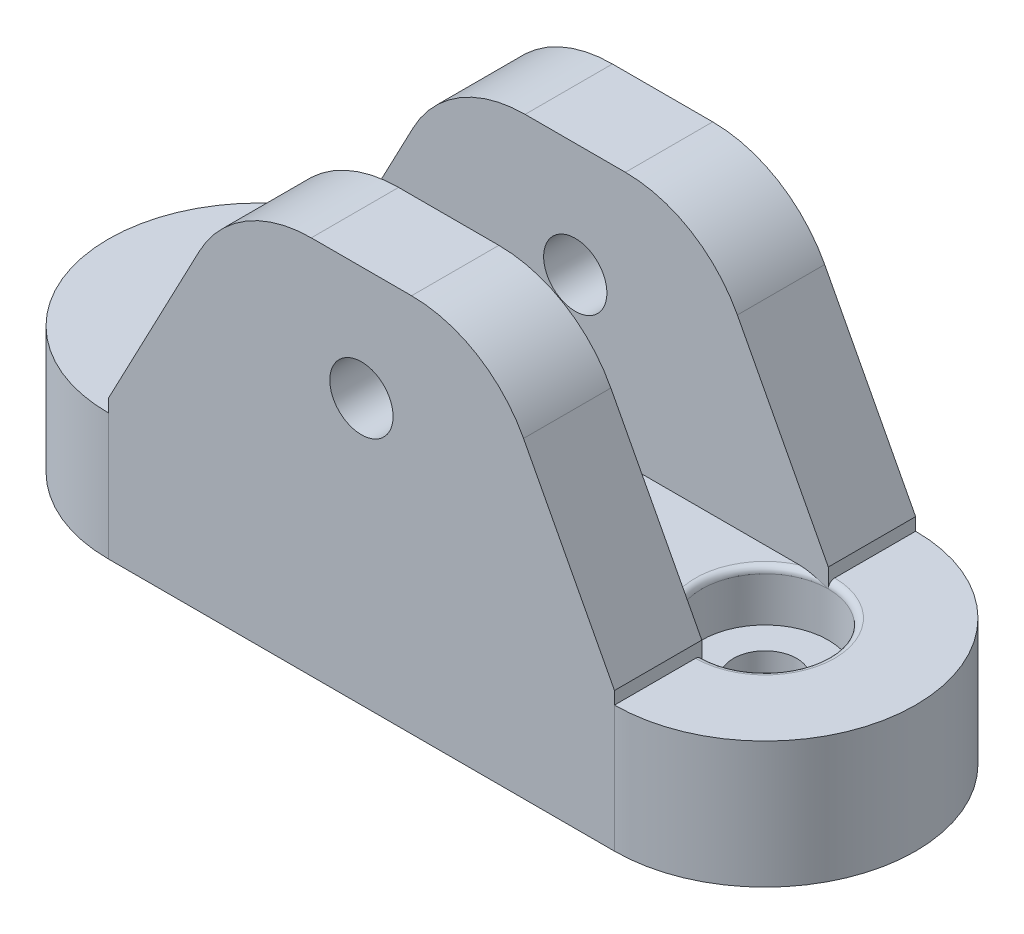
from build123d import *

# Parameters (mm, degrees)
CROQUIS1_R              = 2.5
SALIENTE_EXTRUIR1_DEPTH = 10
CROQUIS3_R              = 2.5
SALIENTE_EXTRUIR2_DEPTH = 6.9
MATRIZL1_COUNT          = 2
MATRIZL1_PITCH          = 16.9
CROQUIS6_R              = 5
CORTAR_EXTRUIR1_DEPTH   = 4
REDONDEO3_R             = 0.5


with BuildPart() as part:
    # Croquis1 → Saliente-Extruir1 (new body)
    with BuildSketch(Plane(origin=(0, 0, 0), x_dir=(1, 0, 0), z_dir=(0, 1, 0))):
        with BuildLine():
            Line((0, -11.9), (-40, -11.9))
            ThreePointArc((-40, -11.9), (-51.9, 0), (-40, 11.9))
            Line((-40, 11.9), (0, 11.9))
            ThreePointArc((0, 11.9), (11.9, 0), (0, -11.9))
        make_face()
        with Locations(Location((-40, 0, 0), (0, 0, 270))):
            Circle(CROQUIS1_R, mode=Mode.SUBTRACT)
        with Locations(Location((0, 0, 0), (0, 0, 90))):
            Circle(CROQUIS1_R, mode=Mode.SUBTRACT)
    extrude(amount=SALIENTE_EXTRUIR1_DEPTH)

    # Croquis3 → Saliente-Extruir2 (add)
    with BuildSketch(Plane.XY.offset(11.9)):
        with BuildLine():
            Line((-40, 10), (-40, 11))
            Line((-40, 11), (-32.81186088, 24.657464328))
            ThreePointArc((-32.81186088, 24.657464328), (-29.131109594, 28.56080146), (-23.962678656, 30))
            Line((-23.962678656, 30), (-16.037321344, 30))
            ThreePointArc((-16.037321344, 30), (-10.868890406, 28.56080146), (-7.18813912, 24.657464328))
            Line((-7.18813912, 24.657464328), (0, 11))
            Line((0, 11), (0, 10))
            Line((0, 10), (0, 0))
            Line((0, 0), (-40, 0))
            Line((-40, 0), (-40, 10))
        make_face()
        with Locations((-20, 21)):
            Circle(CROQUIS3_R, mode=Mode.SUBTRACT)
    saliente_extruir2 = extrude(amount=-SALIENTE_EXTRUIR2_DEPTH)

    # MatrizL1: Saliente-Extruir2 ×2
    with Locations(*[(0, 0, -i * MATRIZL1_PITCH) for i in range(1, MATRIZL1_COUNT)]):
        add(saliente_extruir2)

    # Croquis6 → Cortar-Extruir1 (cut, symmetric)
    with BuildSketch(Plane(origin=(0, 10, 0), x_dir=(1, 0, 0), z_dir=(0, 1, 0))):
        with Locations(Location((-40, 0, 0), (0, 0, 270))):
            Circle(CROQUIS6_R)
        with Locations(Location((0, 0, 0), (0, 0, 90))):
            Circle(CROQUIS6_R)
    extrude(amount=CORTAR_EXTRUIR1_DEPTH, both=True, mode=Mode.SUBTRACT)

    # Redondeo3
    # the kernel refuses this fillet: 0.5 mm, written as the material it takes off along each edge
    with BuildSketch(Plane(origin=(-40, 10, 0), x_dir=(0, 0, -1), z_dir=(1, 0, 0))) as redondeo3_piece_1:
        with BuildLine():
            CenterArc((5 + REDONDEO3_R, -REDONDEO3_R), REDONDEO3_R, 90, 90)
            Line((5, -REDONDEO3_R), (5, 0))
            Line((5, 0), (5 + REDONDEO3_R, 0))
        make_face()
    revolve(axis=Axis((-40, 10, 0), (0, 1, 0)), revolution_arc=180, mode=Mode.SUBTRACT)
    with BuildSketch(Plane(origin=(-40, 10, 0), x_dir=(0, 0, 1), z_dir=(-1, 0, 0))) as redondeo3_piece_2_section:
        with BuildLine():
            CenterArc((5 + REDONDEO3_R, -REDONDEO3_R), REDONDEO3_R, 90, 90)
            Line((5 + REDONDEO3_R, 0), (5, 0))
            Line((5, 0), (5, -REDONDEO3_R))
        make_face()
    redondeo3_piece_2 = revolve(axis=Axis((-40, 10, 0), (0, 1, 0)), revolution_arc=180, mode=Mode.PRIVATE)
    redondeo3_piece_2 = split(redondeo3_piece_2, bisect_by=Plane(origin=(-34.859999019, 9.859999019, -5), z_dir=(0, 0, 1)), keep=Keep.TOP, mode=Mode.PRIVATE)
    redondeo3_piece_2 = split(redondeo3_piece_2, bisect_by=Plane(origin=(-34.859999019, 9.859999019, 5), z_dir=(0, 0, -1)), keep=Keep.TOP, mode=Mode.PRIVATE)
    add(redondeo3_piece_2, mode=Mode.SUBTRACT)
    with BuildSketch(Plane(origin=(0, 10, 0), x_dir=(0, 0, -1), z_dir=(1, 0, 0))) as redondeo3_piece_3_section:
        with BuildLine():
            CenterArc((5 + REDONDEO3_R, -REDONDEO3_R), REDONDEO3_R, 90, 90)
            Line((5, -REDONDEO3_R), (5, 0))
            Line((5, 0), (5 + REDONDEO3_R, 0))
        make_face()
    redondeo3_piece_3 = revolve(axis=Axis((0, 10, 0), (0, 1, 0)), revolution_arc=180, mode=Mode.PRIVATE)
    redondeo3_piece_3 = split(redondeo3_piece_3, bisect_by=Plane(origin=(-5.140000985, 9.859999015, -5), z_dir=(0, 0, 1)), keep=Keep.TOP, mode=Mode.PRIVATE)
    redondeo3_piece_3 = split(redondeo3_piece_3, bisect_by=Plane(origin=(-5.140000985, 9.859999015, 5), z_dir=(0, 0, -1)), keep=Keep.TOP, mode=Mode.PRIVATE)
    add(redondeo3_piece_3, mode=Mode.SUBTRACT)
    with BuildSketch(Plane(origin=(0, 10, 0), x_dir=(0, 0, 1), z_dir=(-1, 0, 0))) as redondeo3_piece_4:
        with BuildLine():
            CenterArc((5 + REDONDEO3_R, -REDONDEO3_R), REDONDEO3_R, 90, 90)
            Line((5, -REDONDEO3_R), (5, 0))
            Line((5, 0), (5 + REDONDEO3_R, 0))
        make_face()
    revolve(axis=Axis((0, 10, 0), (0, 1, 0)), revolution_arc=180, mode=Mode.SUBTRACT)


solid = part.part
